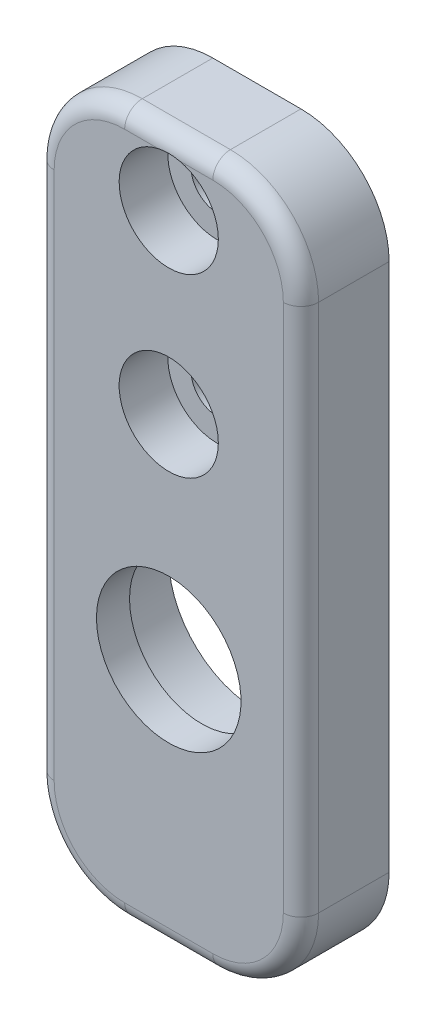
from build123d import *

# Parameters (mm, degrees)
SKETCH1_W                                      = 6.35
SKETCH1_H                                      = 50.8
BODY_DEPTH                                     = 19.05
SKETCH2_R                                      = 5.207
PITCH_AXLE_OPENING_DEPTH                       = 6.35
CBORE_FOR_6_SOCKET_HEAD_CAP_SCREW1_D           = 3.7973
CBORE_FOR_6_SOCKET_HEAD_CAP_SCREW1_CBORE_D     = 7.14502
CBORE_FOR_6_SOCKET_HEAD_CAP_SCREW1_CBORE_DEPTH = 3.5052
FILLET1_R                                      = 6.35
FILLET2_R                                      = 1.27
SKETCH2_3_R                                    = 6.35
SKETCH2_3_R_2                                  = 5.207
BEARING_RECESS_DEPTH                           = 3.96748


with BuildPart() as part:
    # Sketch1 → Body (new body)
    with BuildSketch(Plane(origin=(0, 0, 0), x_dir=(0, 0, -1), z_dir=(1, 0, 0))):
        with Locations((3.175, 25.4)):
            Rectangle(SKETCH1_W, SKETCH1_H)
    extrude(amount=BODY_DEPTH)

    # Sketch2 → Pitch Axle Opening (cut)
    with BuildSketch(Plane(origin=(0, 0, -6.35), x_dir=(-1, 0, 0), z_dir=(0, 0, -1))):
        with Locations((-9.525, 18.034)):
            Circle(SKETCH2_R)
    extrude(amount=-PITCH_AXLE_OPENING_DEPTH, mode=Mode.SUBTRACT)

    # CBORE for #6 Socket Head Cap Screw1 (through all)
    with Locations(Plane.XY):
        with Locations((9.525, 46.0375), (9.525, 33.3375)):
            CounterBoreHole(CBORE_FOR_6_SOCKET_HEAD_CAP_SCREW1_D / 2, CBORE_FOR_6_SOCKET_HEAD_CAP_SCREW1_CBORE_D / 2, CBORE_FOR_6_SOCKET_HEAD_CAP_SCREW1_CBORE_DEPTH)

    # Fillet1
    fillet1_edges = [part.edges().sort_by_distance(p)[0] for p in [
        (19.05, 50.8, -3.175),
        (19.05, 0, -3.175),
        (0, 50.8, -3.175),
        (0, 0, -3.175),
    ]]
    fillet(fillet1_edges, radius=FILLET1_R)

    # Fillet2
    # the kernel refuses this fillet: 1.27 mm, written as the material it takes off along each edge
    with BuildSketch(Plane(origin=(6.35, 50.8, 0), x_dir=(0, -1, 0), z_dir=(1, 0, 0))) as fillet2_piece_1:
        with BuildLine():
            CenterArc((FILLET2_R, FILLET2_R), FILLET2_R, 180, 90)
            Line((0, FILLET2_R), (0, 0))
            Line((0, 0), (FILLET2_R, 0))
        make_face()
    extrude(amount=6.35, mode=Mode.SUBTRACT)
    with BuildSketch(Plane(origin=(0, 6.35, 0), x_dir=(1, 0, 0), z_dir=(0, 1, 0))) as fillet2_piece_2:
        with BuildLine():
            CenterArc((FILLET2_R, FILLET2_R), FILLET2_R, 180, 90)
            Line((0, FILLET2_R), (0, 0))
            Line((0, 0), (FILLET2_R, 0))
        make_face()
    extrude(amount=38.1, mode=Mode.SUBTRACT)
    with BuildSketch(Plane(origin=(6.35, 0, 0), x_dir=(0, 1, 0), z_dir=(1, 0, 0))) as fillet2_piece_3:
        with BuildLine():
            CenterArc((FILLET2_R, -FILLET2_R), FILLET2_R, 90, 90)
            Line((0, -FILLET2_R), (0, 0))
            Line((0, 0), (FILLET2_R, 0))
        make_face()
    extrude(amount=6.35, mode=Mode.SUBTRACT)
    with BuildSketch(Plane(origin=(19.05, 6.35, 0), x_dir=(-1, 0, 0), z_dir=(0, 1, 0))) as fillet2_piece_4:
        with BuildLine():
            CenterArc((FILLET2_R, -FILLET2_R), FILLET2_R, 90, 90)
            Line((0, -FILLET2_R), (0, 0))
            Line((0, 0), (FILLET2_R, 0))
        make_face()
    extrude(amount=38.1, mode=Mode.SUBTRACT)
    with BuildSketch(Plane(origin=(12.7, 6.35, 0), x_dir=(0, -1, 0), z_dir=(-1, 0, 0))) as fillet2_piece_5:
        with BuildLine():
            CenterArc((6.35 - FILLET2_R, -FILLET2_R), FILLET2_R, 0, 90)
            Line((6.35, -FILLET2_R), (6.35, 0))
            Line((6.35, 0), (6.35 - FILLET2_R, 0))
        make_face()
    revolve(axis=Axis((12.7, 6.35, 0), (0, 0, 1)), revolution_arc=90, mode=Mode.SUBTRACT)
    with BuildSketch(Plane(origin=(6.35, 6.35, 0), x_dir=(0, -1, 0), z_dir=(1, 0, 0))) as fillet2_piece_6:
        with BuildLine():
            CenterArc((6.35 - FILLET2_R, FILLET2_R), FILLET2_R, 270, 90)
            Line((6.35, FILLET2_R), (6.35, 0))
            Line((6.35, 0), (6.35 - FILLET2_R, 0))
        make_face()
    revolve(axis=Axis((6.35, 6.35, 0), (0, 0, -1)), revolution_arc=90, mode=Mode.SUBTRACT)
    with BuildSketch(Plane(origin=(12.7, 44.45, 0), x_dir=(1, 0, 0), z_dir=(0, -1, 0))) as fillet2_piece_7:
        with BuildLine():
            CenterArc((6.35 - FILLET2_R, -FILLET2_R), FILLET2_R, 0, 90)
            Line((6.35, -FILLET2_R), (6.35, 0))
            Line((6.35, 0), (6.35 - FILLET2_R, 0))
        make_face()
    revolve(axis=Axis((12.7, 44.45, 0), (0, 0, 1)), revolution_arc=90, mode=Mode.SUBTRACT)
    with BuildSketch(Plane(origin=(6.35, 44.45, 0), x_dir=(-1, 0, 0), z_dir=(0, -1, 0))) as fillet2_piece_8:
        with BuildLine():
            CenterArc((6.35 - FILLET2_R, FILLET2_R), FILLET2_R, 270, 90)
            Line((6.35, FILLET2_R), (6.35, 0))
            Line((6.35, 0), (6.35 - FILLET2_R, 0))
        make_face()
    revolve(axis=Axis((6.35, 44.45, 0), (0, 0, -1)), revolution_arc=90, mode=Mode.SUBTRACT)

    # Sketch2<3> → Bearing Recess (cut)
    with BuildSketch(Plane(origin=(0, 0, -6.35), x_dir=(-1, 0, 0), z_dir=(0, 0, -1))):
        with Locations((-9.525, 18.034)):
            Circle(SKETCH2_3_R)
        with Locations((-9.525, 18.034)):
            Circle(SKETCH2_3_R_2, mode=Mode.SUBTRACT)
    extrude(amount=-BEARING_RECESS_DEPTH, mode=Mode.SUBTRACT)


solid = part.part
